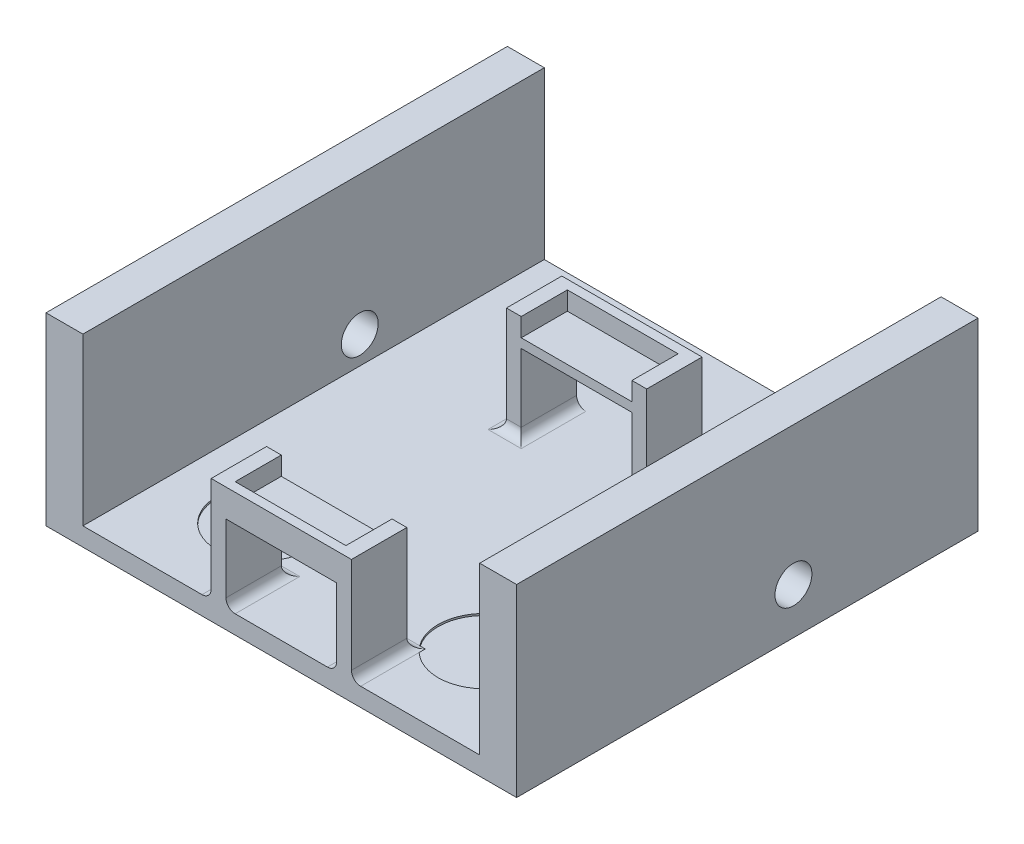
from build123d import *

# Parameters (mm, degrees)
SKETCH_4_W             = 255
SKETCH_4_H             = 250
EXTRUDE_2_DEPTH        = 10
SKETCH_7_W             = 20
SKETCH_7_H             = 250
EXTRUDE_3_DEPTH        = 90
EXTRUDE_4_DEPTH        = 30
CUT_EXTRUDE_1_REACH    = 303.081
SKETCH_9_R             = 10
SKETCH_11_W            = 60
SKETCH_11_H            = 10
EXTRUDE_6_DEPTH        = 5
FILLET_1_R             = 5
FILLET_1_OF_MIRROR_2_R = 5
SKETCH_12_R            = 25
CUT_EXTRUDE_2_DEPTH    = 1


with BuildPart() as part:
    # 草圖4 → 填料-伸長2 (new body)
    with BuildSketch(Plane(origin=(0, 0, 0), x_dir=(1, 0, 0), z_dir=(0, 1, 0))):
        Rectangle(SKETCH_4_W, SKETCH_4_H)
    extrude(amount=EXTRUDE_2_DEPTH)

    # 草圖7 → 填料-伸長3 (add)
    with BuildSketch(Plane(origin=(0, 10, 0), x_dir=(1, 0, 0), z_dir=(0, 1, 0))):
        with Locations((-117.5, 0)):
            Rectangle(SKETCH_7_W, SKETCH_7_H)
        with Locations((117.5, 0)):
            Rectangle(SKETCH_7_W, SKETCH_7_H)
    extrude(amount=EXTRUDE_3_DEPTH)

    # 草圖8 → 填料-伸長4 (add)
    with BuildSketch(Plane.XY.offset(125)):
        Polygon((-30, 10), (-38, 10), (-38, 67), (-30, 67), (-30, 57), (30, 57), (30, 67), (38, 67), (38, 10), (30, 10), (30, 52), (-30, 52), align=None)
    extrude_4 = extrude(amount=-EXTRUDE_4_DEPTH)

    # 草圖9 → 除料-伸長1 (cut, up to next)
    with BuildSketch(Plane.ZY.offset(127.5), mode=Mode.PRIVATE) as cut_extrude_1_sk1:
        with Locations((-25, 25)):
            Circle(SKETCH_9_R)
    cut_extrude_1_tool1 = extrude(cut_extrude_1_sk1.sketch, amount=-CUT_EXTRUDE_1_REACH, mode=Mode.PRIVATE) & part.part
    cut_extrude_1 = cut_extrude_1_tool1.solids().sort_by_distance((-127.5, 25, -25))[0]
    add(cut_extrude_1, mode=Mode.SUBTRACT)

    # 鏡射1: 除料-伸長1 across plane
    add(cut_extrude_1.mirror(Plane(origin=(0, 0, 0), x_dir=(0, 0, 1), z_dir=(1, 0, 0))), mode=Mode.SUBTRACT)

    # 草圖11 → 填料-伸長6 (add)
    with BuildSketch(Plane.XY.offset(125)):
        with Locations((0, 62)):
            Rectangle(SKETCH_11_W, SKETCH_11_H)
    extrude_6 = extrude(amount=-EXTRUDE_6_DEPTH)

    # 圓角1
    fillet_1_edges = [part.edges().sort_by_distance(p)[0] for p in [
        (38, 10, 110),
        (-38, 10, 110),
        (30, 10, 110),
        (-30, 10, 110),
        (-34, 10, 95),
        (34, 10, 95),
    ]]
    fillet(fillet_1_edges, radius=FILLET_1_R)

    # 鏡射2: 填料-伸長4, 填料-伸長6 across plane
    add(extrude_4.mirror(Plane(origin=(0, 0, 30), x_dir=(1, 0, 0), z_dir=(0, 0, -1))))
    add(extrude_6.mirror(Plane(origin=(0, 0, 30), x_dir=(1, 0, 0), z_dir=(0, 0, -1))))

    # 圓角1 of 鏡射2
    fillet_1_of_mirror_2_edges = [part.edges().sort_by_distance(p)[0] for p in [
        (38, 10, -50),
        (-38, 10, -50),
        (30, 10, -50),
        (-30, 10, -50),
        (-34, 10, -35),
        (34, 10, -35),
    ]]
    fillet(fillet_1_of_mirror_2_edges, radius=FILLET_1_OF_MIRROR_2_R)

    # 草圖12 → 除料-伸長2 (cut)
    with BuildSketch(Plane(origin=(0, 10, 0), x_dir=(1, 0, 0), z_dir=(0, 1, 0))):
        with Locations((-60, -75)):
            Circle(SKETCH_12_R)
        with Locations((60, -75)):
            Circle(SKETCH_12_R)
    extrude(amount=-CUT_EXTRUDE_2_DEPTH, mode=Mode.SUBTRACT)


solid = part.part
